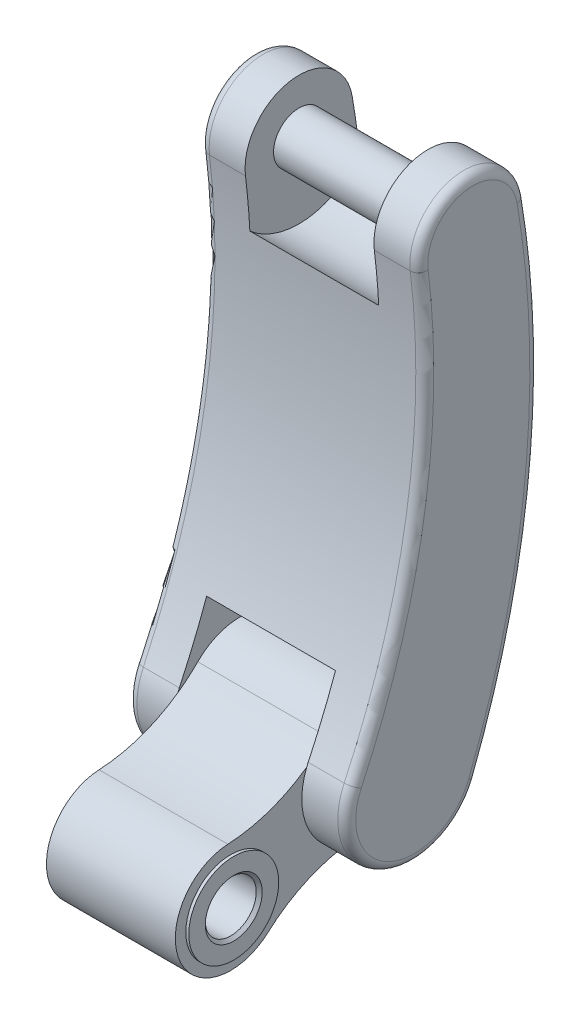
from build123d import *

# Parameters (mm, degrees)
SKETCH1_R           = 42.5
BOSS_EXTRUDE1_DEPTH = 107.5
SKETCH2_R           = 75
SKETCH2_R_2         = 42.5
BOSS_EXTRUDE2_DEPTH = 5
BOSS_EXTRUDE3_START = 5
SKETCH3_R           = 75
SKETCH3_R_2         = 42.5
BOSS_EXTRUDE3_DEPTH = 5
CHAMFER1_SIZE       = 5
BOSS_EXTRUDE4_DEPTH = 75
BOSS_EXTRUDE5_START = 75
BOSS_EXTRUDE5_DEPTH = 75
FILLET2_R           = 15
SKETCH7_R           = 42.5
BOSS_EXTRUDE6_DEPTH = 215


with BuildPart() as part:
    # Sketch1 → Boss-Extrude1 (new, symmetric)
    with BuildSketch(Plane(origin=(0, 0, 0), x_dir=(0, 0, -1), z_dir=(1, 0, 0))):
        with BuildLine():
            ThreePointArc((-4.759905033, 92.377450193), (-85.458856757, -35.398217494), (61.954960333, -68.686482587))
            ThreePointArc((61.954960333, -68.686482587), (140.229582164, -20.76943431), (230.521573397, -4.328136996))
            ThreePointArc((230.521573397, -4.328136996), (323.357836379, 133.939201328), (159.94291274, 166.063822779))
            ThreePointArc((159.94291274, 166.063822779), (84.471080629, 113.843496313), (-4.759905033, 92.377450193))
        make_face()
        Circle(SKETCH1_R, mode=Mode.SUBTRACT)
    extrude(amount=BOSS_EXTRUDE1_DEPTH, both=True)

    # Sketch2 → Boss-Extrude2 (add)
    with BuildSketch(Plane(origin=(107.5, 0, 0), x_dir=(0, 0, -1), z_dir=(1, 0, 0))):
        with Locations(Location((0, 0, 0), (0, 0, 180))):
            Circle(SKETCH2_R)
        Circle(SKETCH2_R_2, mode=Mode.SUBTRACT)
    extrude(amount=BOSS_EXTRUDE2_DEPTH)

    # Sketch3 → Boss-Extrude3 (add)
    with BuildSketch(Plane.ZY.offset(107.5).offset(BOSS_EXTRUDE3_START)):
        Circle(SKETCH3_R)
        Circle(SKETCH3_R_2, mode=Mode.SUBTRACT)
    extrude(amount=-BOSS_EXTRUDE3_DEPTH)

    # Chamfer1
    # the kernel refuses this chamfer: 5 mm, written as the material it takes off along each edge
    with BuildSketch(Plane(origin=(112.5, 0, 0), x_dir=(0, 0, -1), z_dir=(0, -1, 0))) as chamfer1_piece_1:
        Polygon((42.5 + CHAMFER1_SIZE, 0), (42.5, -CHAMFER1_SIZE), (42.5, 0), align=None)
    revolve(axis=Axis((112.5, 0, 0), (1, 0, 0)), mode=Mode.SUBTRACT)
    with BuildSketch(Plane(origin=(-112.5, 0, 0), x_dir=(0, 0, 1), z_dir=(0, -1, 0))) as chamfer1_piece_2:
        Polygon((42.5 + CHAMFER1_SIZE, 0), (42.5, -CHAMFER1_SIZE), (42.5, 0), align=None)
    revolve(axis=Axis((-112.5, 0, 0), (-1, 0, 0)), mode=Mode.SUBTRACT)

    # Sketch5 → Boss-Extrude4 (add)
    with BuildSketch(Plane.ZY.offset(107.5)):
        with BuildLine():
            ThreePointArc((-335.722160279, 54.643910463), (-186.43026552, -7.636801177), (-129.224593262, 143.672378798))
            ThreePointArc((-129.224593262, 143.672378798), (-232.809942482, 478.212645548), (-239.526554212, 828.358332052))
            ThreePointArc((-239.526554212, 828.358332052), (-315.830208714, 928.305649758), (-417.57768021, 854.419480204))
            ThreePointArc((-417.57768021, 854.419480204), (-431.229967878, 448.945530482), (-335.722160279, 54.643910463))
        make_face()
    extrude(amount=BOSS_EXTRUDE4_DEPTH)

    # Sketch6 → Boss-Extrude5 (add)
    with BuildSketch(Plane(origin=(107.5, 0, 0), x_dir=(0, 0, -1), z_dir=(1, 0, 0)).offset(BOSS_EXTRUDE5_START)):
        with BuildLine():
            ThreePointArc((129.224593262, 143.672378798), (232.809942482, 478.212645548), (239.526554212, 828.358332052))
            ThreePointArc((239.526554212, 828.358332052), (315.830208714, 928.305649758), (417.57768021, 854.419480204))
            ThreePointArc((417.57768021, 854.419480204), (431.229967878, 448.945530482), (335.722160279, 54.643910463))
            ThreePointArc((335.722160279, 54.643910463), (186.43026552, -7.636801177), (129.224593262, 143.672378798))
        make_face()
    extrude(amount=-BOSS_EXTRUDE5_DEPTH)

    # Fillet2
    fillet2_edges = [part.edges().sort_by_distance(p)[0] for p in [
        (-182.5, 478.212645548, -232.809942482),
        (-182.5, 928.305649758, -315.830208714),
        (-182.5, 448.945530482, -431.229967878),
        (-182.5, -7.636801177, -186.43026552),
        (182.5, -7.636801177, -186.43026552),
        (182.5, 448.945530482, -431.229967878),
        (182.5, 928.305649758, -315.830208714),
        (182.5, 478.212645548, -232.809942482),
    ]]
    fillet(fillet2_edges, radius=FILLET2_R)

    # Sketch7 → Boss-Extrude6 (add)
    with BuildSketch(Plane.ZY.offset(-107.5)):
        with Locations(Location((-328.864527293, 839.254504122, 0), (0, 0, 180))):
            Circle(SKETCH7_R)
        with BuildLine():
            ThreePointArc((-430.016772116, 765.815935458), (-433.115150694, 468.647268594), (-377.566301605, 176.700112622))
            ThreePointArc((-377.566301605, 176.700112622), (-290.266675416, 252.323787921), (-174.772654288, 253.462244012))
            ThreePointArc((-174.772654288, 253.462244012), (-235.480184212, 495.562856506), (-246.877162179, 744.898412841))
            ThreePointArc((-246.877162179, 744.898412841), (-343.049337537, 715.061947347), (-430.016772116, 765.815935458))
        make_face()
    extrude(amount=BOSS_EXTRUDE6_DEPTH)


solid = part.part
